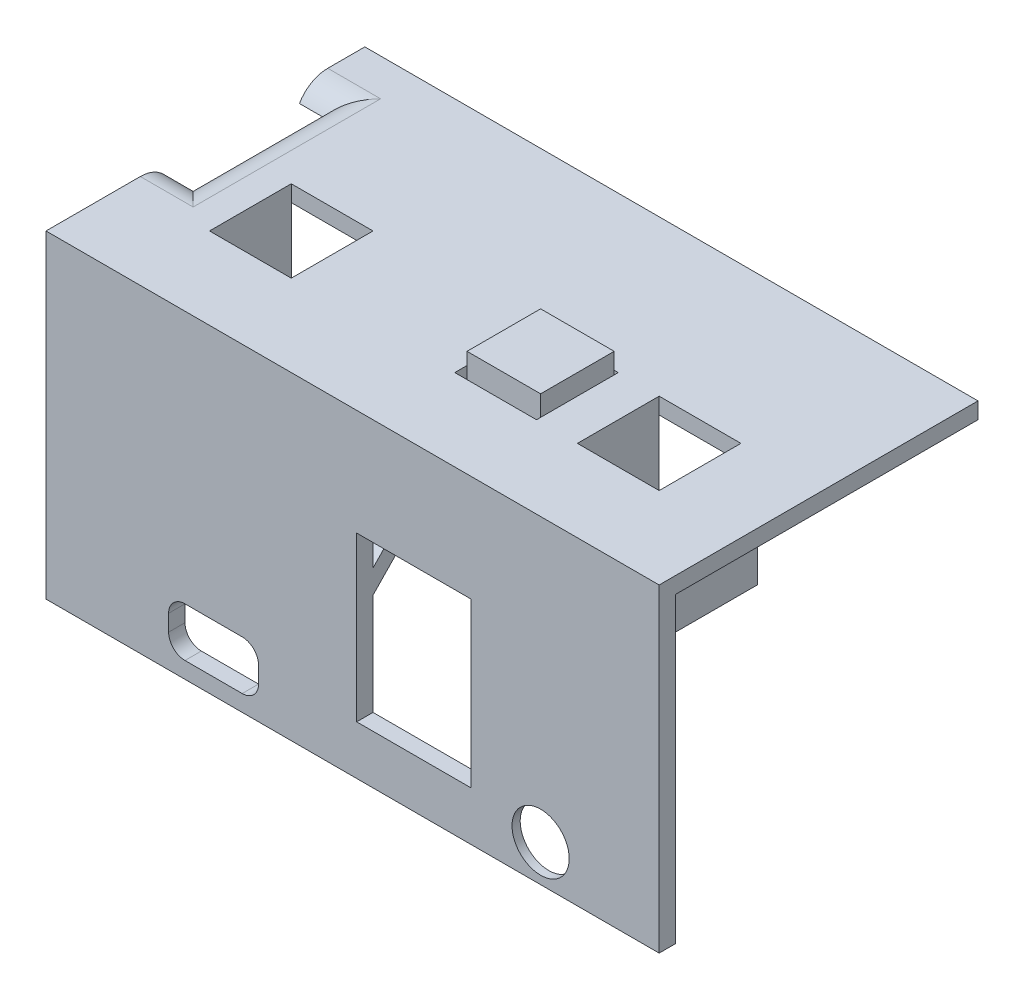
from build123d import *

# Parameters (mm, degrees)
SKETCH1_W                 = 75
SKETCH1_H                 = 39
BOSS_EXTRUDE1_DEPTH       = 2
SKETCH2_W                 = 75
SKETCH2_H                 = 2
BOSS_EXTRUDE2_DEPTH       = 38
SKETCH4_R                 = 3.5
SKETCH4_R_2               = 2.25
SKETCH4_W                 = 11
SKETCH4_H                 = 6
CUT_EXTRUDE1_DEPTH        = 2
SKETCH6_W                 = 10
SKETCH6_H                 = 10
CUT_EXTRUDE2_DEPTH        = 2
BOSS_EXTRUDE3_DEPTH       = 10
SKETCH8_W                 = 14
SKETCH8_H                 = 12
BOSS_EXTRUDE4_DEPTH       = 2
SKETCH9_W                 = 10
SKETCH9_H                 = 10
BOSS_EXTRUDE5_DEPTH       = 4
SKETCH10_W                = 9.9
SKETCH10_H                = 9.9
SKETCH10_W_2              = 5.9
SKETCH10_H_2              = 5.9
BOSS_EXTRUDE9_DEPTH       = 2
SKETCH11_W                = 9.9
SKETCH11_H                = 1.85
BOSS_EXTRUDE10_DEPTH      = 4
SKETCH12_R                = 4.25
SKETCH12_R_2              = 2.25
BOSS_EXTRUDE11_DEPTH      = 2
SKETCH16_W                = 14
SKETCH16_H                = 9.5
SKETCH16_W_2              = 11
SKETCH16_H_2              = 6
BOSS_EXTRUDE13_DEPTH      = 2
CUT_EXTRUDE3_DEPTH        = 65.955754172
FILLET1_R                 = 2
FILLET2_R                 = 2
BOSS_EXTRUDE14_DEPTH      = 2
BOSS_EXTRUDE14_DEPTH_BACK = 2
CUT_EXTRUDE4_DEPTH        = 7
CUT_EXTRUDE4_DEPTH_BACK   = 10
SKETCH19_W                = 14
SKETCH19_H                = 20
SKETCH22_W                = 14
SKETCH22_H                = 14
BOSS_EXTRUDE15_DEPTH      = 3
FILLET3_R                 = 7
SKETCH23_R                = 3.05
CUT_EXTRUDE6_DEPTH        = 4
SKETCH24_W                = 1
SKETCH24_H                = 12
BOSS_EXTRUDE16_DEPTH      = 12
SKETCH25_W                = 16.318850604
SKETCH25_H                = 8.975597068
SKETCH25_W_2              = 14
SKETCH25_H_2              = 9.692484115
CUT_EXTRUDE7_DEPTH        = 2
CUT_EXTRUDE8_START        = -2
SKETCH26_R                = 4.25
CUT_EXTRUDE8_DEPTH        = 2
SKETCH27_R                = 2.25
BOSS_EXTRUDE17_DEPTH      = 2
SKETCH28_W                = 85.525995753
SKETCH28_H                = 26.786934063
CUT_EXTRUDE9_DEPTH        = 1
BOSS_EXTRUDE18_DEPTH      = 1
CUT_EXTRUDE10_DEPTH       = 10
CUT_EXTRUDE11_START       = -1
SKETCH31_W                = 15
SKETCH31_H                = 9
SKETCH31_R                = 3.5
CUT_EXTRUDE11_DEPTH       = 1
SKETCH32_W                = 20
SKETCH32_H                = 8
CUT_EXTRUDE12_DEPTH       = 1
BOSS_EXTRUDE19_START      = -1
SKETCH34_W                = 14
SKETCH34_H                = 1
BOSS_EXTRUDE19_DEPTH      = 1
SKETCH35_W                = 3
SKETCH35_H                = 16
CUT_EXTRUDE13_DEPTH       = 66.545785524
FILLET4_R                 = 4
SKETCH36_W                = 0.4
SKETCH36_H                = 4
CUT_EXTRUDE14_DEPTH       = 10
SKETCH38_W                = 9.5
SKETCH38_H                = 7.5
CUT_EXTRUDE15_DEPTH       = 2
CUT_EXTRUDE16_DEPTH       = 10


# Some blends are built 0.0001 mm under size
with BuildPart() as part:
    # Sketch1 → Boss-Extrude1 (new body)
    with BuildSketch(Plane.XY):
        Rectangle(SKETCH1_W, SKETCH1_H)
    extrude(amount=BOSS_EXTRUDE1_DEPTH)

    # Sketch2 → Boss-Extrude2 (add)
    with BuildSketch(Plane(origin=(0, 0, 0), x_dir=(-1, 0, 0), z_dir=(0, 0, -1))):
        with Locations((0, 18.5)):
            Rectangle(SKETCH2_W, SKETCH2_H)
    extrude(amount=BOSS_EXTRUDE2_DEPTH)

    # Sketch4 → Cut-Extrude1 (cut)
    with BuildSketch(Plane.XY.offset(2)):
        with Locations((23, -15)):
            Circle(SKETCH4_R)
        with Locations((23, 4.5)):
            Circle(SKETCH4_R_2)
        with Locations((-17, -14.5)):
            Rectangle(SKETCH4_W, SKETCH4_H)
    extrude(amount=-CUT_EXTRUDE1_DEPTH, mode=Mode.SUBTRACT)

    # Sketch6 → Cut-Extrude2 (cut)
    with BuildSketch(Plane(origin=(0, 19.5, 0), x_dir=(1, 0, 0), z_dir=(0, 1, 0))):
        with Locations((7.5, 13)):
            Rectangle(SKETCH6_W, SKETCH6_H)
        with Locations((22.5, 13)):
            Rectangle(SKETCH6_W, SKETCH6_H)
        with Locations((-22.5, 13)):
            Rectangle(SKETCH6_W, SKETCH6_H)
    extrude(amount=-CUT_EXTRUDE2_DEPTH, mode=Mode.SUBTRACT)

    # Sketch7 → Boss-Extrude3 (add)
    with BuildSketch(Plane.XZ.offset(-17.5)):
        Polygon((17.5, -8), (17.5, -18), (15.5, -18), (15.5, -8), (15.5, -6), (29.5, -6), (29.5, -8), (29.5, -18), (27.5, -18), (27.5, -8), align=None)
        Polygon((2.5, -8), (2.5, -18), (0.5, -18), (0.5, -8), (0.5, -6), (14.5, -6), (14.5, -8), (14.5, -18), (12.5, -18), (12.5, -8), align=None)
        Polygon((-17.5, -8), (-17.5, -18), (-15.5, -18), (-15.5, -8), (-15.5, -6), (-29.5, -6), (-29.5, -8), (-29.5, -18), (-27.5, -18), (-27.5, -8), align=None)
    extrude(amount=BOSS_EXTRUDE3_DEPTH)

    # Sketch8 → Boss-Extrude4 (add)
    with BuildSketch(Plane.XZ.offset(-7.5)):
        with Locations((-22.5, -12)):
            Rectangle(SKETCH8_W, SKETCH8_H)
        with Locations((7.5, -12)):
            Rectangle(SKETCH8_W, SKETCH8_H)
        with Locations((22.5, -12)):
            Rectangle(SKETCH8_W, SKETCH8_H)
    extrude(amount=BOSS_EXTRUDE4_DEPTH)

    # Sketch12 → Boss-Extrude11 (add)
    with BuildSketch(Plane(origin=(0, 0, 0), x_dir=(-1, 0, 0), z_dir=(0, 0, -1))):
        with Locations(Location((-23, 4.5, 0), (0, 0, 180))):
            Circle(SKETCH12_R)
        with Locations(Location((-23, 4.5, 0), (0, 0, 180))):
            Circle(SKETCH12_R_2, mode=Mode.SUBTRACT)
    extrude(amount=BOSS_EXTRUDE11_DEPTH)

    # Sketch16 → Boss-Extrude13 (add)
    with BuildSketch(Plane(origin=(0, 0, 0), x_dir=(-1, 0, 0), z_dir=(0, 0, -1))):
        with Locations((17, -14.75)):
            Rectangle(SKETCH16_W, SKETCH16_H)
        with Locations((17, -14.5)):
            Rectangle(SKETCH16_W_2, SKETCH16_H_2, mode=Mode.SUBTRACT)
    extrude(amount=BOSS_EXTRUDE13_DEPTH)

    # Fillet1
    fillet1_edges = [part.edges().sort_by_distance(p)[0] for p in [
        (-22.5, -17.5, 0),
        (-22.5, -11.5, 0),
        (-11.5, -11.5, 0),
        (-11.5, -17.5, 0),
    ]]
    fillet(fillet1_edges, radius=FILLET1_R)

    # Fillet2
    fillet2_edges = [part.edges().sort_by_distance(p)[0] for p in [
        (-10, -10, -1),
        (-24, -10, -1),
    ]]
    fillet(fillet2_edges, radius=FILLET2_R)

    # Sketch18 → Boss-Extrude14 (add, two sides: drawn at the far end of the back side and taken through both)
    with BuildSketch(Plane.ZY.offset(-BOSS_EXTRUDE14_DEPTH_BACK)):
        Polygon((-15.16634768, 17.5), (0, 1.799618541), (0, -1.079036274), (-17.947087746, 17.5), align=None)
    extrude(amount=BOSS_EXTRUDE14_DEPTH + BOSS_EXTRUDE14_DEPTH_BACK)

    # Sketch19 → Cut-Extrude4 (cut, two sides: drawn at the far end of the back side and taken through both)
    with BuildSketch(Plane(origin=(0, 0, 0), x_dir=(-1, 0, 0), z_dir=(0, 0, -1)).offset(-CUT_EXTRUDE4_DEPTH_BACK)):
        with Locations((-7.5, -3.5)):
            Rectangle(SKETCH19_W, SKETCH19_H)
    extrude(amount=CUT_EXTRUDE4_DEPTH + CUT_EXTRUDE4_DEPTH_BACK, mode=Mode.SUBTRACT)

    # Sketch22 → Boss-Extrude15 (add)
    with BuildSketch(Plane(origin=(0, 0, -38), x_dir=(-1, 0, 0), z_dir=(0, 0, -1))):
        with Locations((-22.5, 12.5)):
            Rectangle(SKETCH22_W, SKETCH22_H)
        with Locations((22.5, 12.5)):
            Rectangle(SKETCH22_W, SKETCH22_H)
    extrude(amount=-BOSS_EXTRUDE15_DEPTH)

    # Fillet3
    fillet3_edges = [part.edges().sort_by_distance(p)[0] for p in [
        (-29.5, 5.5, -36.5),
        (-15.5, 5.5, -36.5),
        (15.5, 5.5, -36.5),
        (29.5, 5.5, -36.5),
    ]]
    fillet(fillet3_edges, radius=FILLET3_R - 0.0001)  # a hair under: the kernel refuses the full size

    # Sketch23 → Cut-Extrude6 (cut)
    with BuildSketch(Plane(origin=(0, 0, -38), x_dir=(-1, 0, 0), z_dir=(0, 0, -1))):
        with Locations((-22.5, 12.5)):
            Circle(SKETCH23_R)
        with Locations((22.5, 12.5)):
            Circle(SKETCH23_R)
    extrude(amount=-CUT_EXTRUDE6_DEPTH, mode=Mode.SUBTRACT)

    # Sketch24 → Boss-Extrude16 (add)
    with BuildSketch(Plane.XZ.offset(-5.5)):
        with Locations((15, -12)):
            Rectangle(SKETCH24_W, SKETCH24_H)
    extrude(amount=-BOSS_EXTRUDE16_DEPTH)

    # Sketch25 → Cut-Extrude7 (cut)
    with BuildSketch(Plane(origin=(0, 0, -2), x_dir=(-1, 0, 0), z_dir=(0, 0, -1))):
        with Locations((-23, -15)):
            Rectangle(SKETCH25_W, SKETCH25_H)
        with Locations((17, -14.653757943)):
            Rectangle(SKETCH25_W_2, SKETCH25_H_2)
    extrude(amount=-CUT_EXTRUDE7_DEPTH, mode=Mode.SUBTRACT)

    # Sketch26 → Cut-Extrude8 (cut)
    with BuildSketch(Plane(origin=(0, 0, -2), x_dir=(-1, 0, 0), z_dir=(0, 0, -1)).offset(CUT_EXTRUDE8_START)):
        with Locations((-23, 4.5)):
            Circle(SKETCH26_R)
    extrude(amount=CUT_EXTRUDE8_DEPTH, mode=Mode.SUBTRACT)

    # Sketch27 → Boss-Extrude17 (add)
    with BuildSketch(Plane.XY.offset(2)):
        with Locations((23, 4.5)):
            Circle(SKETCH27_R)
    extrude(amount=-BOSS_EXTRUDE17_DEPTH)

    # Sketch28 → Cut-Extrude9 (cut)
    with BuildSketch(Plane(origin=(0, 0, -38), x_dir=(-1, 0, 0), z_dir=(0, 0, -1))):
        with Locations((0.270543114, 11.591218851)):
            Rectangle(SKETCH28_W, SKETCH28_H)
    extrude(amount=-CUT_EXTRUDE9_DEPTH, mode=Mode.SUBTRACT)

    # Sketch29 → Boss-Extrude18 (add)
    with BuildSketch(Plane.XY.offset(-35)):
        with BuildLine():
            Line((15.5, 17.5), (29.5, 17.5))
            Line((29.5, 17.5), (29.5, 12.5))
            ThreePointArc((29.5, 12.5), (22.5, 5.5), (15.5, 12.5))
            Line((15.5, 12.5), (15.5, 17.5))
        make_face()
    boss_extrude18 = extrude(amount=BOSS_EXTRUDE18_DEPTH)

    # Mirror1: Boss-Extrude18 across plane
    add(boss_extrude18.mirror(Plane.ZY))

    # Sketch31 → Cut-Extrude11 (cut)
    with BuildSketch(Plane(origin=(0, 0, 0), x_dir=(-1, 0, 0), z_dir=(0, 0, -1)).offset(CUT_EXTRUDE11_START)):
        with Locations((-24.5, -15)):
            Rectangle(SKETCH31_W, SKETCH31_H)
        with Locations(Location((-23, -15, 0), (0, 0, 180))):
            Circle(SKETCH31_R, mode=Mode.SUBTRACT)
    extrude(amount=CUT_EXTRUDE11_DEPTH, mode=Mode.SUBTRACT)

    # Sketch32 → Cut-Extrude12 (cut)
    with BuildSketch(Plane.XZ.offset(-17.5)):
        with Locations((0, -28)):
            Rectangle(SKETCH32_W, SKETCH32_H)
    extrude(amount=-CUT_EXTRUDE12_DEPTH, mode=Mode.SUBTRACT)

    # Sketch34 → Boss-Extrude19 (add)
    with BuildSketch(Plane.XZ.offset(-5.5).offset(BOSS_EXTRUDE19_START)):
        with Locations((7.5, -6.5)):
            Rectangle(SKETCH34_W, SKETCH34_H)
    extrude(amount=BOSS_EXTRUDE19_DEPTH)

    # Sketch35 → Cut-Extrude13 (cut, through all)
    with BuildSketch(Plane(origin=(0, 19.5, 0), x_dir=(1, 0, 0), z_dir=(0, 1, 0))):
        with Locations((-36, 21)):
            Rectangle(SKETCH35_W, SKETCH35_H)
    extrude(amount=-CUT_EXTRUDE13_DEPTH, mode=Mode.SUBTRACT)

    # Fillet4
    # the kernel refuses this fillet: 4 mm, written as the material it takes off along each edge
    with BuildSketch(Plane(origin=(-34.5, 19.5, -13), x_dir=(0, 0, 1), z_dir=(-1, 0, 0)), Plane(origin=(-46.160254038, 19.5, -29), x_dir=(0, 0, -1), z_dir=(1, 0, 0))) as fillet4_piece_1:
        with BuildLine():
            CenterArc((3.464101615, -4), FILLET4_R, 90, 60)
            Line((0, -2), (-0.069282032, -1.96))
            ThreePointArc((-0.069282032, -1.96), (-0.08, -1), (-0.08, 0))
            Line((-0.08, 0), (0, 0.08))
            Line((0, 0.08), (3.464101615, 0.08))
            Line((3.464101615, 0.08), (3.464101615, 0))
        make_face()
    extrude(amount=11.660254038, mode=Mode.SUBTRACT)
    with BuildSketch(Plane(origin=(-34.5, 19.5, -29), x_dir=(1, 0, 0), z_dir=(0, 0, 1))) as fillet4_piece_2:
        with BuildLine():
            CenterArc((3.464101615, -4), FILLET4_R, 90, 60)
            Line((0, -2), (-0.069282032, -1.96))
            ThreePointArc((-0.069282032, -1.96), (-0.08, -1), (-0.08, 0))
            Line((-0.08, 0), (0, 0.08))
            Line((0, 0.08), (3.464101615, 0.08))
            Line((3.464101615, 0.08), (3.464101615, 0))
        make_face()
    extrude(amount=16, mode=Mode.SUBTRACT)
    with BuildSketch(Plane(origin=(-25.839745962, 19.5, -13), x_dir=(0, 0, 1), z_dir=(-1, 0, 0))) as fillet4_piece_3a_section:
        with BuildLine():
            CenterArc((3.464101615, -4), FILLET4_R, 90, 60)
            Line((0, -2), (-0.069282032, -1.96))
            ThreePointArc((-0.069282032, -1.96), (-0.08, -1), (-0.08, 0))
            Line((-0.08, 0), (0, 0.08))
            Line((0, 0.08), (3.464101615, 0.08))
            Line((3.464101615, 0.08), (3.464101615, 0))
        make_face()
    fillet4_piece_3a = extrude(amount=20.320508076, mode=Mode.PRIVATE)
    fillet4_piece_3a = split(fillet4_piece_3a, bisect_by=Plane(origin=(-34.5, 18.981933156, -12.134758217), z_dir=(1, 0, 0)), keep=Keep.TOP, mode=Mode.PRIVATE)
    with BuildSketch(Plane(origin=(-34.5, 19.5, -29), x_dir=(1, 0, 0), z_dir=(0, 0, 1))) as fillet4_piece_3b_section:
        with BuildLine():
            CenterArc((3.464101615, -4), FILLET4_R, 90, 60)
            Line((0, -2), (-0.069282032, -1.96))
            ThreePointArc((-0.069282032, -1.96), (-0.08, -1), (-0.08, 0))
            Line((-0.08, 0), (0, 0.08))
            Line((0, 0.08), (3.464101615, 0.08))
            Line((3.464101615, 0.08), (3.464101615, 0))
        make_face()
    fillet4_piece_3b = extrude(amount=24.660254038, mode=Mode.PRIVATE)
    fillet4_piece_3b = split(fillet4_piece_3b, bisect_by=Plane(origin=(-33.634758217, 18.981933156, -13), z_dir=(0, 0, 1)), keep=Keep.TOP, mode=Mode.PRIVATE)
    fillet4_piece_3 = fillet4_piece_3a & fillet4_piece_3b
    add(fillet4_piece_3, mode=Mode.SUBTRACT)
    with BuildSketch(Plane(origin=(-34.5, 19.5, -37.660254038), x_dir=(1, 0, 0), z_dir=(0, 0, 1))) as fillet4_piece_4a_section:
        with BuildLine():
            CenterArc((3.464101615, -4), FILLET4_R, 90, 60)
            Line((0, -2), (-0.069282032, -1.96))
            ThreePointArc((-0.069282032, -1.96), (-0.08, -1), (-0.08, 0))
            Line((-0.08, 0), (0, 0.08))
            Line((0, 0.08), (3.464101615, 0.08))
            Line((3.464101615, 0.08), (3.464101615, 0))
        make_face()
    fillet4_piece_4a = extrude(amount=24.660254038, mode=Mode.PRIVATE)
    fillet4_piece_4a = split(fillet4_piece_4a, bisect_by=Plane(origin=(-33.634758217, 18.981933156, -29), z_dir=(0, 0, -1)), keep=Keep.TOP, mode=Mode.PRIVATE)
    with BuildSketch(Plane(origin=(-46.160254038, 19.5, -29), x_dir=(0, 0, -1), z_dir=(1, 0, 0))) as fillet4_piece_4b_section:
        with BuildLine():
            CenterArc((3.464101615, -4), FILLET4_R, 90, 60)
            Line((0, -2), (-0.069282032, -1.96))
            ThreePointArc((-0.069282032, -1.96), (-0.08, -1), (-0.08, 0))
            Line((-0.08, 0), (0, 0.08))
            Line((0, 0.08), (3.464101615, 0.08))
            Line((3.464101615, 0.08), (3.464101615, 0))
        make_face()
    fillet4_piece_4b = extrude(amount=20.320508076, mode=Mode.PRIVATE)
    fillet4_piece_4b = split(fillet4_piece_4b, bisect_by=Plane(origin=(-34.5, 18.981933156, -29.865241783), z_dir=(1, 0, 0)), keep=Keep.TOP, mode=Mode.PRIVATE)
    fillet4_piece_4 = fillet4_piece_4a & fillet4_piece_4b
    add(fillet4_piece_4, mode=Mode.SUBTRACT)


with BuildPart() as body_2:
    # Sketch9 → Boss-Extrude5 (new body)
    with BuildSketch(Plane.XZ.offset(-17.5)):
        with Locations((7.5, -13)):
            Rectangle(SKETCH9_W, SKETCH9_H)
    extrude(amount=-BOSS_EXTRUDE5_DEPTH)

    # Sketch10 → Boss-Extrude9 (add)
    with BuildSketch(Plane.XZ.offset(-17.5)):
        with Locations((7.55, -13.05)):
            Rectangle(SKETCH10_W, SKETCH10_H)
        with Locations((7.55, -13.05)):
            Rectangle(SKETCH10_W_2, SKETCH10_H_2, mode=Mode.SUBTRACT)
    extrude(amount=BOSS_EXTRUDE9_DEPTH)

    # Sketch11 → Boss-Extrude10 (add)
    with BuildSketch(Plane(origin=(0, 0, -18), x_dir=(-1, 0, 0), z_dir=(0, 0, -1))):
        with Locations((-7.55, 16.425)):
            Rectangle(SKETCH11_W, SKETCH11_H)
    extrude(amount=BOSS_EXTRUDE10_DEPTH)

    # Sketch17 → Cut-Extrude3 (cut, through all)
    with BuildSketch(Plane.XZ.offset(-17.5)):
        Polygon((2.5, -8.1), (2.5, -18), (2.6, -18), (2.6, -8.1), (12.5, -8.1), (12.5, -8), (2.6, -8), (2.5, -8), align=None)
    extrude(amount=-CUT_EXTRUDE3_DEPTH, mode=Mode.SUBTRACT)

    # Sketch30 → Cut-Extrude10 (cut)
    with BuildSketch(Plane(origin=(0, 21.5, 0), x_dir=(1, 0, 0), z_dir=(0, 1, 0))):
        Polygon((2.5, 18), (3, 18), (3, 8.5), (12.5, 8.5), (12.5, 8), (2.5, 8), align=None)
    extrude(amount=-CUT_EXTRUDE10_DEPTH, mode=Mode.SUBTRACT)

    # Sketch36 → Cut-Extrude14 (cut)
    with BuildSketch(Plane.XZ.offset(-15.5)):
        with Locations((2.8, -20)):
            Rectangle(SKETCH36_W, SKETCH36_H)
    extrude(amount=-CUT_EXTRUDE14_DEPTH, mode=Mode.SUBTRACT)

    # Sketch38 → Cut-Extrude15 (cut)
    with BuildSketch(Plane.XZ.offset(-15.5)):
        with Locations((7.75, -12.25)):
            Rectangle(SKETCH38_W, SKETCH38_H)
    extrude(amount=-CUT_EXTRUDE15_DEPTH, mode=Mode.SUBTRACT)

    # Sketch39 → Cut-Extrude16 (cut)
    with BuildSketch(Plane(origin=(0, 21.5, 0), x_dir=(1, 0, 0), z_dir=(0, 1, 0))):
        Polygon((12.5, 8.5), (3, 8.5), (3, 9), (12, 9), (12, 22), (12.5, 22), align=None)
    extrude(amount=-CUT_EXTRUDE16_DEPTH, mode=Mode.SUBTRACT)


solid = Compound([part.part, body_2.part])
